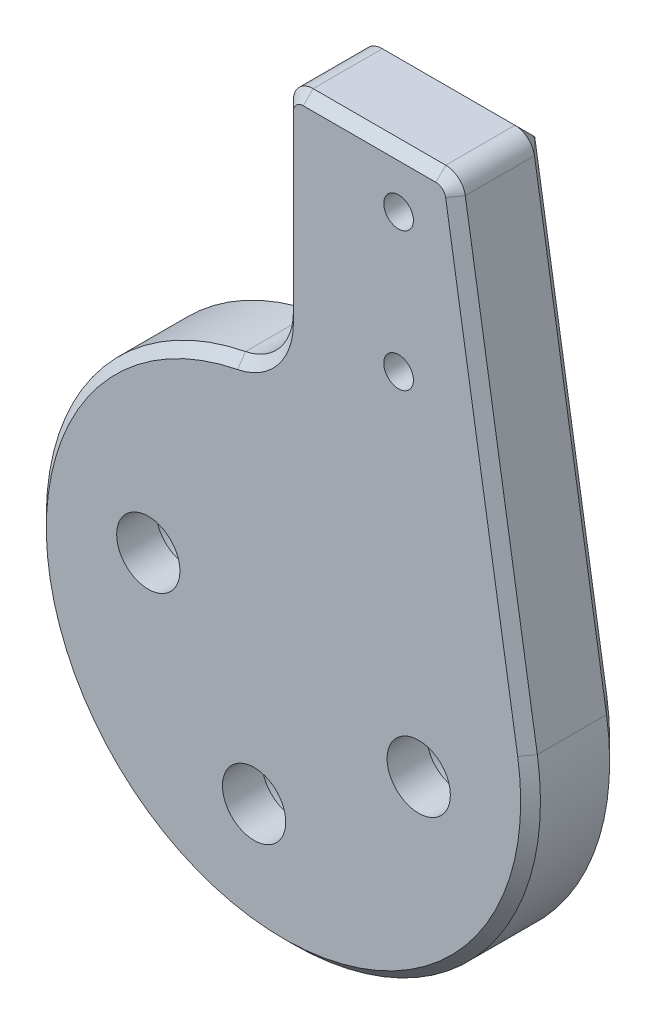
from build123d import *

# Parameters (mm, degrees)
SKETCH1_R                = 1.6
SKETCH1_R_2              = 1.6000000000000016
SKETCH1_R_3              = 0.7500000000000004
BOSS_EXTRUDE1_DEPTH      = 5
CHAMFER1_SIZE            = 1
CHAMFER2_SIZE            = 0.5
SKETCH2_R                = 2.8000000000000003
SKETCH2_R_2              = 2.8
CUT_EXTRUDE1_DEPTH       = 3
CHAMFER3_SIZE            = 0.5
CHAMFER1_OF_MIRROR1_SIZE = 1
CHAMFER3_OF_MIRROR1_SIZE = 0.5
SKETCH3_R                = 37.34251173427861
CUT_EXTRUDE2_DEPTH       = 5


with BuildPart() as part:
    # Sketch1 → Boss-Extrude1 (new body)
    with BuildSketch(Plane.XY):
        with BuildLine():
            Line((7.708608571885691, 25.491602871293395), (1.000000000000007, 25.491602871293395))
            ThreePointArc((1.000000000000007, 25.491602871293395), (0.2928932188134533, 25.198709652479938), (2.2e-16, 24.491602871293384))
            Line((-3e-17, 24.491602871293384), (-1e-17, 15.206906325619645))
            ThreePointArc((0, 15.206906325619645), (-0.6824651584188803, 13.301904420618609), (-2.41935483870505, 12.263634133540775))
            ThreePointArc((-2.4193548387050505, 12.263634133540775), (-7.143139121953686, -10.257951232157748), (12.341389732124409, 1.9849683817950803))
            Line((12.341389732124407, 1.9849683817950847), (8.695919750465407, 24.650400341838562))
            ThreePointArc((8.695919750465407, 24.650400341838562), (8.357146361630761, 25.2527853298883), (7.708608571885691, 25.491602871293395))
        make_face()
        with Locations((-1.487499999936831, -6.840127466035101)):
            Circle(SKETCH1_R, mode=Mode.SUBTRACT)
        with Locations((-6.84012746585444, 1.4874999998823886)):
            Circle(SKETCH1_R, mode=Mode.SUBTRACT)
        with Locations((6.840127465980755, -1.4875000001175058)):
            Circle(SKETCH1_R_2, mode=Mode.SUBTRACT)
        with Locations((5.820860522174176, 15.749999999999972)):
            Circle(SKETCH1_R_3, mode=Mode.SUBTRACT)
        with Locations((5.820860522174148, 22.74999999999998)):
            Circle(SKETCH1_R_3, mode=Mode.SUBTRACT)
    boss_extrude1 = extrude(amount=BOSS_EXTRUDE1_DEPTH)

    # Chamfer1
    chamfer1_edges = [part.edges().sort_by_distance(p)[0] for p in [
        (-0.6824651584188803, 13.301904420618609, 5),
        (-7.1431391219536895, -10.257951232157744, 5),
        (-2e-17, 19.849254598456515, 5),
        (10.518654741294906, 13.317684361816823, 5),
        (0.2928932188134541, 25.198709652479938, 5),
        (8.357146361630761, 25.2527853298883, 5),
        (4.354304285942849, 25.491602871293395, 5),
    ]]
    chamfer(chamfer1_edges, length=CHAMFER1_SIZE)

    # Chamfer2
    chamfer2_edges = [part.edges().sort_by_distance(p)[0] for p in [
        (5.070860522174176, 15.749999999999972, 5),
        (5.070860522174147, 22.74999999999998, 5),
    ]]
    chamfer(chamfer2_edges, length=CHAMFER2_SIZE)

    # Sketch2 → Cut-Extrude1 (cut)
    with BuildSketch(Plane.XY.offset(5)):
        with Locations((-6.84012746585444, 1.4874999998823886)):
            Circle(SKETCH2_R)
        with Locations((-1.487499999936831, -6.840127466035101)):
            Circle(SKETCH2_R_2)
        with Locations((6.840127465980755, -1.4875000001175058)):
            Circle(SKETCH2_R)
    cut_extrude1 = extrude(amount=-CUT_EXTRUDE1_DEPTH, mode=Mode.SUBTRACT)

    # Chamfer3
    chamfer3_edges = [part.edges().sort_by_distance(p)[0] for p in [
        (-0.6824651584188803, 13.301904420618609, 0),
        (-7.1431391219536895, -10.257951232157744, 0),
        (-2e-17, 19.849254598456515, 0),
        (10.518654741294906, 13.317684361816823, 0),
        (0.2928932188134541, 25.198709652479938, 0),
        (8.357146361630761, 25.2527853298883, 0),
        (4.354304285942849, 25.491602871293395, 0),
    ]]
    chamfer(chamfer3_edges, length=CHAMFER3_SIZE)


with BuildPart() as mirror1_1:
    # Mirror1: Boss-Extrude1 across plane
    add(boss_extrude1.mirror(Plane.XY))

    # Mirror1 2: Cut-Extrude1 across plane
    add(cut_extrude1.mirror(Plane.XY), mode=Mode.SUBTRACT)

    # Chamfer1 of Mirror1
    chamfer1_of_mirror1_edges = [mirror1_1.edges().sort_by_distance(p)[0] for p in [
        (-0.6824651584188803, 13.301904420618609, -5),
        (-7.1431391219536895, -10.257951232157744, -5),
        (-2e-17, 19.849254598456515, -5),
        (10.518654741294906, 13.317684361816823, -5),
        (0.2928932188134541, 25.198709652479938, -5),
        (8.357146361630761, 25.2527853298883, -5),
        (4.354304285942849, 25.491602871293395, -5),
    ]]
    chamfer(chamfer1_of_mirror1_edges, length=CHAMFER1_OF_MIRROR1_SIZE)

    # Chamfer3 of Mirror1
    chamfer3_of_mirror1_edges = [mirror1_1.edges().sort_by_distance(p)[0] for p in [
        (-0.6824651584188803, 13.301904420618609, 0),
        (-7.1431391219536895, -10.257951232157744, 0),
        (-2e-17, 19.849254598456515, 0),
        (10.518654741294906, 13.317684361816823, 0),
        (0.2928932188134541, 25.198709652479938, 0),
        (8.357146361630761, 25.2527853298883, 0),
        (4.354304285942849, 25.491602871293395, 0),
    ]]
    chamfer(chamfer3_of_mirror1_edges, length=CHAMFER3_OF_MIRROR1_SIZE)


with BuildPart() as part_1:
    add(part.part)

    # Mirror1 united with what the copies touc: union Mirror1_1
    add(mirror1_1.part)

    # Sketch3 → Cut-Extrude2 (cut)
    with BuildSketch(Plane.XY.offset(5)):
        Circle(SKETCH3_R)
    extrude(amount=-CUT_EXTRUDE2_DEPTH, mode=Mode.SUBTRACT)


solid = part_1.part
